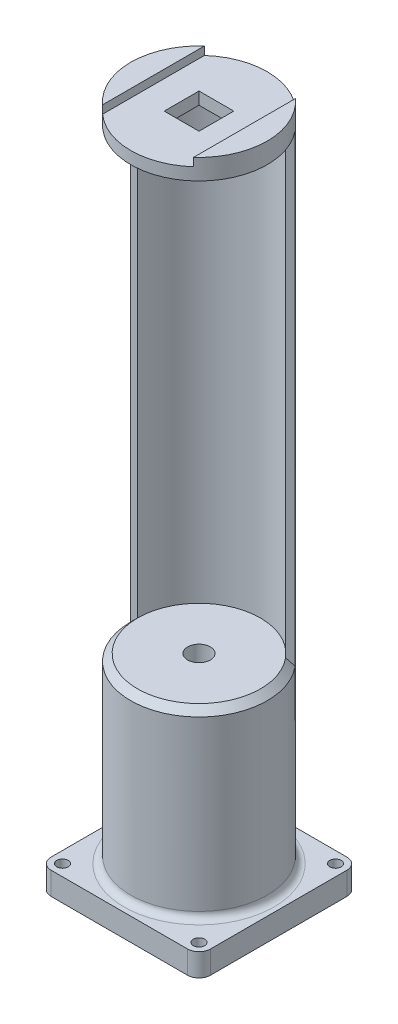
from build123d import *

# Parameters (mm, degrees)
SKETCH1_W                = 350
SKETCH1_H                = 350
BOSS_EXTRUDE1_DEPTH      = 50
FILLET1_R                = 25
SKETCH2_R                = 12.5
CUT_EXTRUDE1_DEPTH       = 50
SKETCH3_R                = 150
BOSS_EXTRUDE2_DEPTH      = 400
FILLET2_R                = 15
CHAMFER1_SIZE            = 15
SKETCH4_R                = 25
CUT_EXTRUDE2_DEPTH       = 669.954408013
SKETCH5_W                = 180
SKETCH5_H                = 180
CUT_EXTRUDE3_DEPTH       = 165
SCALE1_SCALE             = 0.333333333
EXTRUDE_THIN1_DEPTH      = 350
EXTRUDE_THIN1_DEPTH_BACK = 5
BOSS_EXTRUDE3_START      = -15
SKETCH7_R                = 50
BOSS_EXTRUDE3_DEPTH      = 15
SKETCH8_W                = 25.5
SKETCH8_H                = 25.5
CUT_EXTRUDE4_DEPTH       = 9.5
SKETCH9_W                = 66.666666667
SKETCH9_H                = 100
CUT_EXTRUDE5_DEPTH       = 6


with BuildPart() as part:
    # Sketch1 → Boss-Extrude1 (new body)
    with BuildSketch(Plane(origin=(0, 0, 0), x_dir=(1, 0, 0), z_dir=(0, 1, 0))):
        with Locations((175, 175)):
            Rectangle(SKETCH1_W, SKETCH1_H)
    extrude(amount=-BOSS_EXTRUDE1_DEPTH)

    # Fillet1
    fillet1_edges = [part.edges().sort_by_distance(p)[0] for p in [
        (0, -25, -350),
        (350, -25, -350),
        (350, -25, 0),
        (0, -25, 0),
    ]]
    fillet(fillet1_edges, radius=FILLET1_R)

    # Sketch2 → Cut-Extrude1 (cut)
    with BuildSketch(Plane(origin=(0, 0, 0), x_dir=(1, 0, 0), z_dir=(0, 1, 0))):
        with Locations((25, 25)):
            Circle(SKETCH2_R)
        with Locations((325, 25)):
            Circle(SKETCH2_R)
        with Locations((325, 325)):
            Circle(SKETCH2_R)
        with Locations((25, 325)):
            Circle(SKETCH2_R)
    extrude(amount=-CUT_EXTRUDE1_DEPTH, mode=Mode.SUBTRACT)

    # Sketch3 → Boss-Extrude2 (add)
    with BuildSketch(Plane(origin=(0, 0, 0), x_dir=(1, 0, 0), z_dir=(0, 1, 0))):
        with Locations((175, 175)):
            Circle(SKETCH3_R)
    extrude(amount=BOSS_EXTRUDE2_DEPTH)

    # Fillet2
    fillet2_edges = [part.edges().sort_by_distance(p)[0] for p in [
        (25, 0, -175),
    ]]
    fillet(fillet2_edges, radius=FILLET2_R)

    # Chamfer1
    chamfer1_edges = [part.edges().sort_by_distance(p)[0] for p in [
        (25, 400, -175),
    ]]
    chamfer(chamfer1_edges, length=CHAMFER1_SIZE)

    # Sketch4 → Cut-Extrude2 (cut, through all)
    with BuildSketch(Plane(origin=(0, 400, 0), x_dir=(1, 0, 0), z_dir=(0, 1, 0))):
        with Locations((175, 175)):
            Circle(SKETCH4_R)
    extrude(amount=-CUT_EXTRUDE2_DEPTH, mode=Mode.SUBTRACT)

    # Sketch5 → Cut-Extrude3 (cut)
    with BuildSketch(Plane.XZ.offset(50)):
        with Locations((175, -175)):
            Rectangle(SKETCH5_W, SKETCH5_H)
    extrude(amount=-CUT_EXTRUDE3_DEPTH, mode=Mode.SUBTRACT)


with BuildPart() as part_1:
    # Scale1: scaled about (0, 0, 0)
    add(part.part.scale(SCALE1_SCALE))

    # Sketch6 → Extrude-Thin1 (add, two sides: drawn at the far end of the back side and taken through both)
    with BuildSketch(Plane(origin=(0, 133.333333333, 0), x_dir=(1, 0, 0), z_dir=(0, 1, 0)).offset(-EXTRUDE_THIN1_DEPTH_BACK)):
        with BuildLine():
            ThreePointArc((8.333333333, 58.333333333), (41.232326167, 105.317964373), (96.635555489, 90.472713818))
            Line((96.635555489, 90.472713818), (92.805333274, 87.258775769))
            ThreePointArc((92.805333274, 87.258775769), (42.942426884, 100.619501269), (13.333333333, 58.333333333))
            Line((13.333333333, 58.333333333), (8.333333333, 58.333333333))
        make_face()
    extrude(amount=EXTRUDE_THIN1_DEPTH + EXTRUDE_THIN1_DEPTH_BACK)

    # Sketch7 → Boss-Extrude3 (add)
    with BuildSketch(Plane(origin=(0, 483.333333333, 0), x_dir=(1, 0, 0), z_dir=(0, 1, 0)).offset(BOSS_EXTRUDE3_START)):
        with Locations((58.333333333, 58.333333333)):
            Circle(SKETCH7_R)
    extrude(amount=BOSS_EXTRUDE3_DEPTH)

    # Sketch8 → Cut-Extrude4 (cut)
    with BuildSketch(Plane.XZ.offset(-468.333333333)):
        with Locations((58.333333333, -58.333333333)):
            Rectangle(SKETCH8_W, SKETCH8_H)
    extrude(amount=-CUT_EXTRUDE4_DEPTH, mode=Mode.SUBTRACT)

    # Sketch9 → Cut-Extrude5 (cut)
    with BuildSketch(Plane(origin=(0, 483.333333333, 0), x_dir=(1, 0, 0), z_dir=(0, 1, 0))):
        with Locations((58.333333334, 58.333333333)):
            Rectangle(SKETCH9_W, SKETCH9_H)
    extrude(amount=-CUT_EXTRUDE5_DEPTH, mode=Mode.SUBTRACT)


solid = part_1.part
